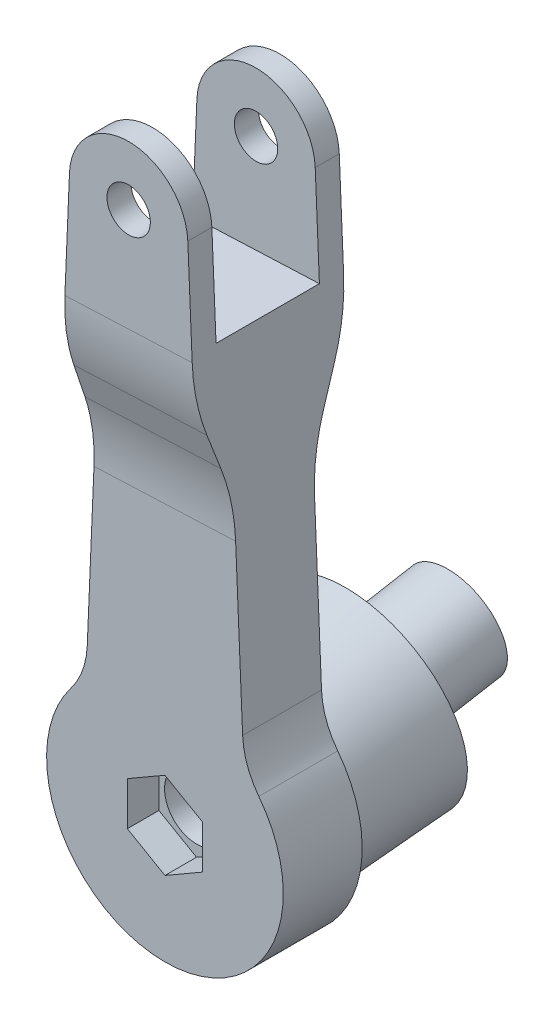
from build123d import *

# Parameters (mm, degrees)
SKETCH1_R               = 2.75
BOSS_EXTRUDE1_DEPTH     = 19.2
CUT_EXTRUDE4_DEPTH      = 84.275329734
CUT_EXTRUDE4_DEPTH_BACK = 84.275329734
SKETCH13_OUTSIDE_W      = 41
SKETCH13_OUTSIDE_H      = 115.36
CUT_EXTRUDE2_DEPTH      = 4
SKETCH4_R               = 4.05
CUT_EXTRUDE3_DEPTH      = 20
FILLET4_R               = 10
BOSS_EXTRUDE2_REACH     = 83.7
SKETCH9_R               = 13
SKETCH10_R              = 6.35
BOSS_EXTRUDE3_DEPTH     = 12
DRAFT1_ANGLE            = -3
FILLET5_R               = 25


with BuildPart() as part:
    # Sketch1 → Boss-Extrude1 (new body)
    with BuildSketch(Plane.XY):
        with BuildLine():
            Line((-7.5, 70.183778092), (-10, 11.180339887))
            ThreePointArc((-10, 11.180339887), (0, -15), (10, 11.180339887))
            Line((10, 11.180339887), (7.5, 70.183778092))
            ThreePointArc((7.5, 70.183778092), (0, 77.372729176), (-7.5, 70.183778092))
        make_face()
        with Locations((0, 69.866)):
            Circle(SKETCH1_R, mode=Mode.SUBTRACT)
    extrude(amount=BOSS_EXTRUDE1_DEPTH)

    # Sketch13 outside → Cut-Extrude4 (cut, two sides: drawn at the far end of the back side and taken through both)
    with BuildSketch(Plane(origin=(10.454946348, 0.442980387, 0), x_dir=(0, 0, -1), z_dir=(0.9991035808766652, 0.042332430587259585, 0)).offset(-CUT_EXTRUDE4_DEPTH_BACK)):
        with Locations((-9.6, 31.158)):
            Rectangle(SKETCH13_OUTSIDE_W, SKETCH13_OUTSIDE_H)
        Polygon((-16.15, 77.310099957), (-16.15, 57.310099957), (-3.05, 57.310099957), (-3.05, 77.310099957), (0, 77.310099957), (0, 52.310099957), (-4.6, 39.671703828), (-4.6, -15), (-14.6, -15), (-14.6, 39.671703828), (-19.2, 52.310099957), (-19.2, 77.310099957), align=None, mode=Mode.SUBTRACT)
    extrude(amount=CUT_EXTRUDE4_DEPTH + CUT_EXTRUDE4_DEPTH_BACK, mode=Mode.SUBTRACT)

    # Sketch3 → Cut-Extrude2 (cut)
    with BuildSketch(Plane.XY.offset(14.6)):
        Polygon((0, 5.500000322), (-4.76314, 2.750000161), (-4.76314, -2.750000161), (0, -5.500000322), (4.76314, -2.750000161), (4.76314, 2.750000161), align=None)
    extrude(amount=-CUT_EXTRUDE2_DEPTH, mode=Mode.SUBTRACT)

    # Sketch4 → Cut-Extrude3 (cut)
    with BuildSketch(Plane.XY.offset(10.6)):
        Circle(SKETCH4_R)
    extrude(amount=-CUT_EXTRUDE3_DEPTH, mode=Mode.SUBTRACT)

    # Fillet4
    fillet4_edges = [part.edges().sort_by_distance(p)[0] for p in [
        (-10, 11.180339887, 9.6),
        (10, 11.180339887, 9.6),
    ]]
    fillet(fillet4_edges, radius=FILLET4_R)

    # Boss-Extrude2: up to this plane
    boss_extrude2_end = Plane(origin=(-17.286936373, 38.974843589, 4.6), z_dir=(0, 0, -1))
    # Sketch9 → Boss-Extrude2 (add, up to the surface)
    with BuildSketch(Plane(origin=(0, 2.715435503, -10.4), x_dir=(-1, 0, 0), z_dir=(0, 0.17364817766692367, -0.9848077530122092)), mode=Mode.PRIVATE) as boss_extrude2_sk1:
        with Locations((0, -0.868240888)):
            Circle(SKETCH9_R)
    boss_extrude2_tool1 = split(extrude(boss_extrude2_sk1.sketch, amount=-BOSS_EXTRUDE2_REACH, mode=Mode.PRIVATE), bisect_by=boss_extrude2_end, keep=Keep.BOTH, mode=Mode.PRIVATE)
    add(boss_extrude2_tool1.solids().sort_by_distance((0, 1.860385, -10.550768))[0])

    # Sketch10 → Boss-Extrude3 (add)
    with BuildSketch(Plane(origin=(0, 1.860385145, -10.550768448), x_dir=(-1, 0, 0), z_dir=(0, 0.17364817766692367, -0.9848077530122092))):
        Circle(SKETCH10_R)
    extrude(amount=BOSS_EXTRUDE3_DEPTH)

    # Draft1
    draft1_faces = [part.faces().sort_by_distance(p)[0] for p in [
        (13, 0.320865392, -1.819718062),
    ]]
    draft(draft1_faces, Plane(origin=(0, 1.860385145, -10.550768448), x_dir=(0, -0.9848077530122092, -0.17364817766692367), z_dir=(0, 0.17364817766692367, -0.9848077530122092)), DRAFT1_ANGLE)

    # Fillet5
    fillet5_edges = [part.edges().sort_by_distance(p)[0] for p in [
        (-0.014820438, 52.356405855, 0),
        (-0.01578265, 39.706629492, 4.6),
        (-0.01578265, 39.706629492, 14.6),
        (-0.014820438, 52.356405855, 19.2),
    ]]
    fillet(fillet5_edges, radius=FILLET5_R)


solid = part.part
